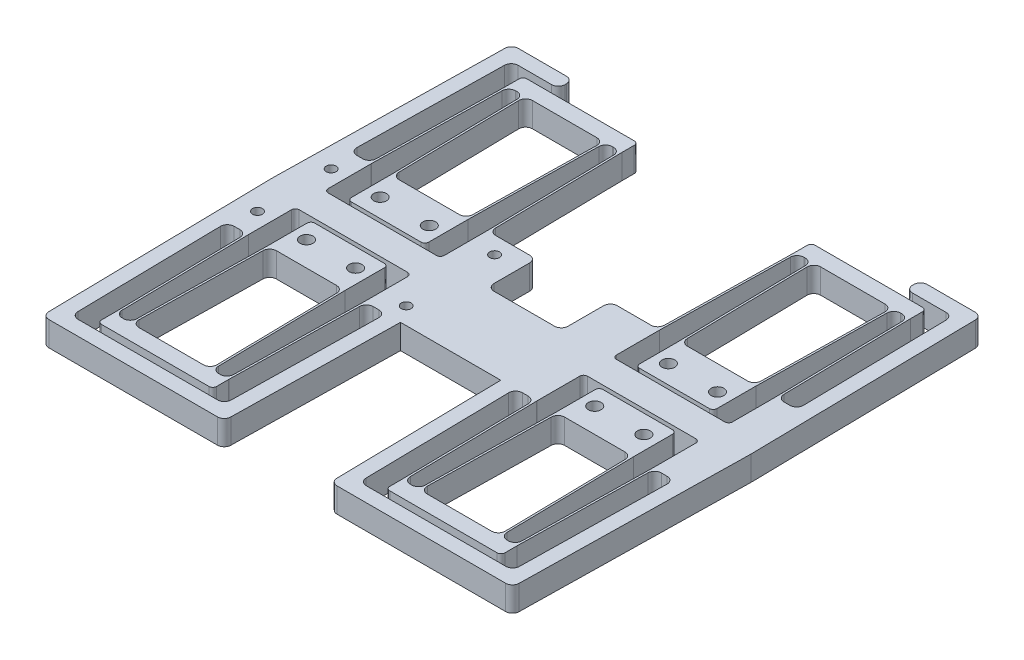
from build123d import *

# Parameters (mm, degrees)
ADJUST_THIS_FLEXTURE_CORNER_W              = 40
ADJUST_THIS_FLEXTURE_CORNER_H              = 22.25
CORNER_EXTRUDE_DEPTH                       = 6.35
FLEXTURE_BEAM_FILLETS_R                    = 3.5
OUTER_FILLETS_R                            = 2
M6_CLEARANCE_HOLE1_D                       = 6.6
FLEXTURE_BEAM_FILLETS_OF_LEFT_RIGHT_MIRR_R = 3.5
OUTER_FILLETS_OF_LEFT_RIGHT_MIRROR_R       = 2
TOP_BOTTOM_MIRROR_START                    = -6.35
TOP_BOTTOM_MIRROR_OUTLINE_R                = 3.3
TOP_BOTTOM_MIRROR_DEPTH                    = 12.7
F_1_4_20_TAPPED_HOLE1_D                    = 5.1054
SKETCH8_W                                  = 38.298
SKETCH8_H                                  = 25.4
CHUCK_CUTOUT_DEPTH                         = 164.761144659
CHUCK_FILLETS_R                            = 3.5
BUMPERS_START                              = -12.7
BUMPERS_DEPTH                              = 12.7
BUMPER_FILLETS_R                           = 3.5


# Read off the part's stored shape, not the designer's step: Top-Bottom-Mirror
with BuildPart() as part:
    # ADJUST THIS Flexture-Corner → Corner-Extrude (new, symmetric)
    with BuildSketch(Plane(origin=(0, 0, 0), x_dir=(1, 0, 0), z_dir=(0, 1, 0))):
        Polygon((-120.65, 0), (0, 0), (0, 31.75), (-44.549, 31.75), (-44.549, 7.5), (-104.549, 7.5), (-104.549, 31.75), (-120.65, 31.75), align=None)
        Polygon((-44.770702217, 101.75), (-44.770702217, 110), (-104.327297783, 110), (-104.327297783, 101.75), (-103.327145455, 101.75), (-95.770854545, 101.75), (-94.770702217, 101.75), (-54.327297783, 101.75), (-53.327145455, 101.75), (-45.770854545, 101.75), align=None)
        with Locations((-74.549, 20.625)):
            Rectangle(ADJUST_THIS_FLEXTURE_CORNER_W, ADJUST_THIS_FLEXTURE_CORNER_H)
        Polygon((-104.327297783, 101.75), (-105.549152328, 31.75), (-104.549, 31.75), (-103.327145455, 101.75), align=None)
        Polygon((-94.549, 31.75), (-95.770854545, 101.75), (-94.770702217, 101.75), (-93.548847672, 31.75), align=None)
        Polygon((-54.549, 31.75), (-53.327145455, 101.75), (-54.327297783, 101.75), (-55.549152328, 31.75), align=None)
        Polygon((-44.770702217, 101.75), (-43.548847672, 31.75), (-44.549, 31.75), (-45.770854545, 101.75), align=None)
    corner_extrude = extrude(amount=CORNER_EXTRUDE_DEPTH, both=True)

    # Flexture-Beam-Fillets
    flexture_beam_fillets_edges = [part.edges().sort_by_distance(p)[0] for p in [
        (-104.549, 0, -31.75),
        (-44.549, 0, -31.75),
        (-105.549152328, 0, -31.75),
        (-43.548847672, 0, -31.75),
        (-54.327297783, 0, -101.75),
        (-53.327145455, 0, -101.75),
        (-95.770854545, 0, -101.75),
        (-94.770702217, 0, -101.75),
        (-103.327145455, 0, -101.75),
        (-45.770854545, 0, -101.75),
        (-44.770702217, 0, -101.75),
        (-104.327297783, 0, -101.75),
        (-93.548847672, 0, -31.75),
        (-55.549152328, 0, -31.75),
        (-94.549, 0, -31.75),
        (-54.549, 0, -31.75),
    ]]
    fillet(flexture_beam_fillets_edges, radius=FLEXTURE_BEAM_FILLETS_R)

    # Outer-Fillets
    outer_fillets_edges = [part.edges().sort_by_distance(p)[0] for p in [
        (-120.65, 0, -31.75),
        (-104.549, 0, -7.5),
        (-44.549, 0, -7.5),
        (-44.770702217, 0, -110),
        (-104.327297783, 0, -110),
        (-94.549, 0, -9.5),
        (-54.549, 0, -9.5),
    ]]
    fillet(outer_fillets_edges, radius=OUTER_FILLETS_R)

    # M6 Clearance Hole1 (through all)
    with Locations(Plane(origin=(0, 6.35, 0), x_dir=(1, 0, 0), z_dir=(0, 1, 0))):
        with Locations((-87.249, -19.05), (-61.849, -19.05), (-61.849, 19.05), (-87.249, 19.05), (61.849, 19.05), (87.249, 19.05), (61.849, -19.05), (87.249, -19.05)):
            m6_clearance_hole1 = Hole(M6_CLEARANCE_HOLE1_D / 2)

    # Left-Right-Mirror: Corner-Extrude, M6 Clearance Hole1 across plane
    add(corner_extrude.mirror(Plane(origin=(0, 0, 0), x_dir=(0, 0, 1), z_dir=(1, 0, 0))))
    add(m6_clearance_hole1.mirror(Plane(origin=(0, 0, 0), x_dir=(0, 0, 1), z_dir=(1, 0, 0))), mode=Mode.SUBTRACT)

    # Flexture-Beam-Fillets of Left-Right-Mirr
    flexture_beam_fillets_of_left_right_mirr_edges = [part.edges().sort_by_distance(p)[0] for p in [
        (104.549, 0, -31.75),
        (44.549, 0, -31.75),
        (105.549152328, 0, -31.75),
        (43.548847672, 0, -31.75),
        (54.327297783, 0, -101.75),
        (53.327145455, 0, -101.75),
        (95.770854545, 0, -101.75),
        (94.770702217, 0, -101.75),
        (103.327145455, 0, -101.75),
        (45.770854545, 0, -101.75),
        (44.770702217, 0, -101.75),
        (104.327297783, 0, -101.75),
        (93.548847672, 0, -31.75),
        (55.549152328, 0, -31.75),
        (94.549, 0, -31.75),
        (54.549, 0, -31.75),
    ]]
    fillet(flexture_beam_fillets_of_left_right_mirr_edges, radius=FLEXTURE_BEAM_FILLETS_OF_LEFT_RIGHT_MIRR_R)

    # Outer-Fillets of Left-Right-Mirror
    outer_fillets_of_left_right_mirror_edges = [part.edges().sort_by_distance(p)[0] for p in [
        (120.65, 0, -31.75),
        (104.549, 0, -7.5),
        (44.549, 0, -7.5),
        (44.770702217, 0, -110),
        (104.327297783, 0, -110),
        (94.549, 0, -9.5),
        (54.549, 0, -9.5),
    ]]
    fillet(outer_fillets_of_left_right_mirror_edges, radius=OUTER_FILLETS_OF_LEFT_RIGHT_MIRROR_R)

    # Top-Bottom-Mirror outline → Top-Bottom-Mirror (add)
    with BuildSketch(Plane(origin=(0, 0, 0), x_dir=(1, 0, 0), z_dir=(0, 1, 0)).offset(TOP_BOTTOM_MIRROR_START)):
        with BuildLine():
            Line((-120.65, 0), (-120.65, -29.75))
            ThreePointArc((-120.65, -29.75), (-120.064213562, -31.164213562), (-118.65, -31.75))
            Line((-118.65, -31.75), (-108.988592749, -31.75))
            ThreePointArc((-108.988592749, -31.75), (-106.535410324, -32.753623428), (-105.489125816, -35.188916577))
            Line((-105.489125816, -35.188916577), (-104.32783085, -101.719460615))
            ThreePointArc((-104.32783085, -101.719460615), (-104.327431052, -101.750001163), (-104.327297783, -101.780544037))
            Line((-104.327297783, -101.780544037), (-104.327297783, -108))
            ThreePointArc((-104.327297783, -108), (-103.741511345, -109.414213562), (-102.327297783, -110))
            Line((-102.327297783, -110), (-46.770702217, -110))
            ThreePointArc((-46.770702217, -110), (-45.356488655, -109.414213562), (-44.770702217, -108))
            Line((-44.770702217, -108), (-44.770702217, -101.780544037))
            ThreePointArc((-44.770702217, -101.780544037), (-44.770568948, -101.750001163), (-44.77016915, -101.719460615))
            Line((-44.77016915, -101.719460615), (-43.608874184, -35.188916577))
            ThreePointArc((-43.608874184, -35.188916577), (-42.562589676, -32.753623428), (-40.109407251, -31.75))
            Line((-40.109407251, -31.75), (40.109407251, -31.75))
            ThreePointArc((40.109407251, -31.75), (42.562589676, -32.753623428), (43.608874184, -35.188916577))
            Line((43.608874184, -35.188916577), (44.77016915, -101.719460615))
            ThreePointArc((44.77016915, -101.719460615), (44.770568948, -101.750001163), (44.770702217, -101.780544037))
            Line((44.770702217, -101.780544037), (44.770702217, -108))
            ThreePointArc((44.770702217, -108), (45.356488655, -109.414213562), (46.770702217, -110))
            Line((46.770702217, -110), (102.327297783, -110))
            ThreePointArc((102.327297783, -110), (103.741511345, -109.414213562), (104.327297783, -108))
            Line((104.327297783, -108), (104.327297783, -101.780544037))
            ThreePointArc((104.327297783, -101.780544037), (104.327431052, -101.750001163), (104.32783085, -101.719460615))
            Line((104.32783085, -101.719460615), (105.489125816, -35.188916577))
            ThreePointArc((105.489125816, -35.188916577), (106.535410324, -32.753623428), (108.988592749, -31.75))
            Line((108.988592749, -31.75), (118.65, -31.75))
            ThreePointArc((118.65, -31.75), (120.064213562, -31.164213562), (120.65, -29.75))
            Line((120.65, -29.75), (120.65, 0))
            Line((120.65, 0), (-120.65, 0))
        make_face()
        with BuildLine():
            ThreePointArc((-93.608874184, -35.188916577), (-92.562589676, -32.753623428), (-90.109407251, -31.75))
            Line((-90.109407251, -31.75), (-58.988592749, -31.75))
            ThreePointArc((-58.988592749, -31.75), (-56.535410324, -32.753623428), (-55.489125816, -35.188916577))
            Line((-55.489125816, -35.188916577), (-54.389456725, -98.188916577))
            ThreePointArc((-54.389456725, -98.188916577), (-55.392547086, -100.703182425), (-57.888923658, -101.75))
            Line((-57.888923658, -101.75), (-91.209076342, -101.75))
            ThreePointArc((-91.209076342, -101.75), (-93.705452914, -100.703182425), (-94.708543275, -98.188916577))
            Line((-94.708543275, -98.188916577), (-93.608874184, -35.188916577))
        make_face(mode=Mode.SUBTRACT)
        with BuildLine():
            Line((58.988592749, -31.75), (90.109407251, -31.75))
            ThreePointArc((90.109407251, -31.75), (92.562589676, -32.753623428), (93.608874184, -35.188916577))
            Line((93.608874184, -35.188916577), (94.708543275, -98.188916577))
            ThreePointArc((94.708543275, -98.188916577), (93.705452914, -100.703182425), (91.209076342, -101.75))
            Line((91.209076342, -101.75), (57.888923658, -101.75))
            ThreePointArc((57.888923658, -101.75), (55.392547086, -100.703182425), (54.389456725, -98.188916577))
            Line((54.389456725, -98.188916577), (55.489125816, -35.188916577))
            ThreePointArc((55.489125816, -35.188916577), (56.535410324, -32.753623428), (58.988592749, -31.75))
        make_face(mode=Mode.SUBTRACT)
        with BuildLine():
            ThreePointArc((-46.549, -7.5), (-45.134786438, -8.085786438), (-44.549, -9.5))
            Line((-44.549, -9.5), (-44.549, -31.719455963))
            ThreePointArc((-44.549, -31.719455963), (-44.549133269, -31.749998837), (-44.549533067, -31.780539385))
            Line((-44.549533067, -31.780539385), (-45.710828033, -98.311083423))
            ThreePointArc((-45.710828033, -98.311083423), (-46.757112541, -100.746376572), (-49.210294966, -101.75))
            Line((-49.210294966, -101.75), (-49.887705034, -101.75))
            ThreePointArc((-49.887705034, -101.75), (-52.340887459, -100.746376572), (-53.387171967, -98.311083423))
            Line((-53.387171967, -98.311083423), (-54.548466933, -31.780539385))
            ThreePointArc((-54.548466933, -31.780539385), (-54.548866731, -31.749998837), (-54.549, -31.719455963))
            Line((-54.549, -31.719455963), (-54.549, -11.5))
            ThreePointArc((-54.549, -11.5), (-55.134786438, -10.085786438), (-56.549, -9.5))
            Line((-56.549, -9.5), (-92.549, -9.5))
            ThreePointArc((-92.549, -9.5), (-93.963213562, -10.085786438), (-94.549, -11.5))
            Line((-94.549, -11.5), (-94.549, -31.719455963))
            ThreePointArc((-94.549, -31.719455963), (-94.549133269, -31.749998837), (-94.549533067, -31.780539385))
            Line((-94.549533067, -31.780539385), (-95.710828033, -98.311083423))
            ThreePointArc((-95.710828033, -98.311083423), (-96.757112541, -100.746376572), (-99.210294966, -101.75))
            Line((-99.210294966, -101.75), (-99.887705034, -101.75))
            ThreePointArc((-99.887705034, -101.75), (-102.340887459, -100.746376572), (-103.387171967, -98.311083423))
            Line((-103.387171967, -98.311083423), (-104.548466933, -31.780539385))
            ThreePointArc((-104.548466933, -31.780539385), (-104.548866731, -31.749998837), (-104.549, -31.719455963))
            Line((-104.549, -31.719455963), (-104.549, -9.5))
            ThreePointArc((-104.549, -9.5), (-103.963213562, -8.085786438), (-102.549, -7.5))
            Line((-102.549, -7.5), (-46.549, -7.5))
        make_face(mode=Mode.SUBTRACT)
        with Locations((-87.249, -19.05)):
            Circle(TOP_BOTTOM_MIRROR_OUTLINE_R, mode=Mode.SUBTRACT)
        with Locations((-61.849, -19.05)):
            Circle(TOP_BOTTOM_MIRROR_OUTLINE_R, mode=Mode.SUBTRACT)
        with BuildLine():
            Line((104.549, -9.5), (104.549, -31.719455963))
            ThreePointArc((104.549, -31.719455963), (104.548866731, -31.749998837), (104.548466933, -31.780539385))
            Line((104.548466933, -31.780539385), (103.387171967, -98.311083423))
            ThreePointArc((103.387171967, -98.311083423), (102.340887459, -100.746376572), (99.887705034, -101.75))
            Line((99.887705034, -101.75), (99.210294966, -101.75))
            ThreePointArc((99.210294966, -101.75), (96.757112541, -100.746376572), (95.710828033, -98.311083423))
            Line((95.710828033, -98.311083423), (94.549533067, -31.780539385))
            ThreePointArc((94.549533067, -31.780539385), (94.549133269, -31.749998837), (94.549, -31.719455963))
            Line((94.549, -31.719455963), (94.549, -11.5))
            ThreePointArc((94.549, -11.5), (93.963213562, -10.085786438), (92.549, -9.5))
            Line((92.549, -9.5), (56.549, -9.5))
            ThreePointArc((56.549, -9.5), (55.134786438, -10.085786438), (54.549, -11.5))
            Line((54.549, -11.5), (54.549, -31.719455963))
            ThreePointArc((54.549, -31.719455963), (54.548866731, -31.749998837), (54.548466933, -31.780539385))
            Line((54.548466933, -31.780539385), (53.387171967, -98.311083423))
            ThreePointArc((53.387171967, -98.311083423), (52.340887459, -100.746376572), (49.887705034, -101.75))
            Line((49.887705034, -101.75), (49.210294966, -101.75))
            ThreePointArc((49.210294966, -101.75), (46.757112541, -100.746376572), (45.710828033, -98.311083423))
            Line((45.710828033, -98.311083423), (44.549533067, -31.780539385))
            ThreePointArc((44.549533067, -31.780539385), (44.549133269, -31.749998837), (44.549, -31.719455963))
            Line((44.549, -31.719455963), (44.549, -9.5))
            ThreePointArc((44.549, -9.5), (45.134786438, -8.085786438), (46.549, -7.5))
            Line((46.549, -7.5), (102.549, -7.5))
            ThreePointArc((102.549, -7.5), (103.963213562, -8.085786438), (104.549, -9.5))
        make_face(mode=Mode.SUBTRACT)
        with Locations((61.849, -19.05)):
            Circle(TOP_BOTTOM_MIRROR_OUTLINE_R, mode=Mode.SUBTRACT)
        with Locations((87.249, -19.05)):
            Circle(TOP_BOTTOM_MIRROR_OUTLINE_R, mode=Mode.SUBTRACT)
    extrude(amount=TOP_BOTTOM_MIRROR_DEPTH)

    # 1/4-20 Tapped Hole1 (through all)
    with Locations(Plane(origin=(0, 6.35, 0), x_dir=(1, 0, 0), z_dir=(0, 1, 0))):
        with Locations((-112.5995, 19.05), (-31.849, 22.86), (-31.849, -22.86), (-112.5995, -19.05)):
            Hole(F_1_4_20_TAPPED_HOLE1_D / 2)

    # Sketch8 → chuck_cutout (cut, through all)
    with BuildSketch(Plane(origin=(0, 6.35, 0), x_dir=(1, 0, 0), z_dir=(0, 1, 0))):
        with Locations((0, 19.05)):
            Rectangle(SKETCH8_W, SKETCH8_H)
    extrude(amount=-CHUCK_CUTOUT_DEPTH, mode=Mode.SUBTRACT)

    # chuck_fillets
    chuck_fillets_edges = [part.edges().sort_by_distance(p)[0] for p in [
        (-19.149, 0, -6.35),
        (-19.149, 0, -31.75),
        (19.149, 0, -31.75),
        (19.149, 0, -6.35),
    ]]
    fillet(chuck_fillets_edges, radius=CHUCK_FILLETS_R)

    # Sketch9 → bumpers (add)
    with BuildSketch(Plane(origin=(0, 6.35, 0), x_dir=(1, 0, 0), z_dir=(0, 1, 0)).offset(BUMPERS_START)):
        with BuildLine():
            Line((-89.856466125, 121.43), (-121.606466125, 121.43))
            Line((-121.606466125, 121.43), (-123.72603466, 0))
            Line((-123.72603466, 0), (-121.606466125, -121.43))
            Line((-121.606466125, -121.43), (-27.491533875, -121.43))
            Line((-27.491533875, -121.43), (-25.926163652, -31.75))
            Line((-25.926163652, -31.75), (-33.547324392, -31.75))
            Line((-33.547324392, -31.75), (-34.97968702, -113.81))
            Line((-34.97968702, -113.81), (-114.11831298, -113.81))
            Line((-114.11831298, -113.81), (-115.550675608, -31.75))
            Line((-115.550675608, -31.75), (-118.65, -31.75))
            ThreePointArc((-118.65, -31.75), (-120.064213562, -31.164213562), (-120.65, -29.75))
            Line((-120.65, -29.75), (-120.65, 29.75))
            ThreePointArc((-120.65, 29.75), (-120.064213562, 31.164213562), (-118.65, 31.75))
            Line((-118.65, 31.75), (-115.550675608, 31.75))
            Line((-115.550675608, 31.75), (-114.11831298, 113.81))
            Line((-114.11831298, 113.81), (-89.856466125, 113.81))
            Line((-89.856466125, 113.81), (-89.856466125, 121.43))
        make_face()
        with BuildLine():
            Line((33.547324392, -31.75), (25.926163652, -31.75))
            Line((25.926163652, -31.75), (27.491533875, -121.43))
            Line((27.491533875, -121.43), (121.606466125, -121.43))
            Line((121.606466125, -121.43), (123.72603466, 0))
            Line((123.72603466, 0), (121.606466125, 121.43))
            Line((121.606466125, 121.43), (89.856466125, 121.43))
            Line((89.856466125, 121.43), (89.856466125, 113.81))
            Line((89.856466125, 113.81), (114.11831298, 113.81))
            Line((114.11831298, 113.81), (115.550675608, 31.75))
            Line((115.550675608, 31.75), (118.65, 31.75))
            ThreePointArc((118.65, 31.75), (120.064213562, 31.164213562), (120.65, 29.75))
            Line((120.65, 29.75), (120.65, -29.75))
            ThreePointArc((120.65, -29.75), (120.064213562, -31.164213562), (118.65, -31.75))
            Line((118.65, -31.75), (115.550675608, -31.75))
            Line((115.550675608, -31.75), (114.11831298, -113.81))
            Line((114.11831298, -113.81), (34.97968702, -113.81))
            Line((34.97968702, -113.81), (33.547324392, -31.75))
        make_face()
    extrude(amount=BUMPERS_DEPTH)

    # bumper_fillets
    bumper_fillets_edges = [part.edges().sort_by_distance(p)[0] for p in [
        (-115.550675608, 0, -31.75),
        (-114.11831298, 0, -113.81),
        (-89.856466125, 0, -113.81),
        (-89.856466125, 0, -121.43),
        (-121.606466125, 0, -121.43),
        (-121.606466125, 0, 121.43),
        (-27.491533875, 0, 121.43),
        (-33.547324392, 0, 31.75),
        (-34.97968702, 0, 113.81),
        (-114.11831298, 0, 113.81),
        (-115.550675608, 0, 31.75),
        (115.550675608, 0, -31.75),
        (114.11831298, 0, -113.81),
        (89.856466125, 0, -113.81),
        (89.856466125, 0, -121.43),
        (121.606466125, 0, -121.43),
        (121.606466125, 0, 121.43),
        (27.491533875, 0, 121.43),
        (33.547324392, 0, 31.75),
        (34.97968702, 0, 113.81),
        (114.11831298, 0, 113.81),
        (115.550675608, 0, 31.75),
    ]]
    fillet(bumper_fillets_edges, radius=BUMPER_FILLETS_R)


solid = part.part
